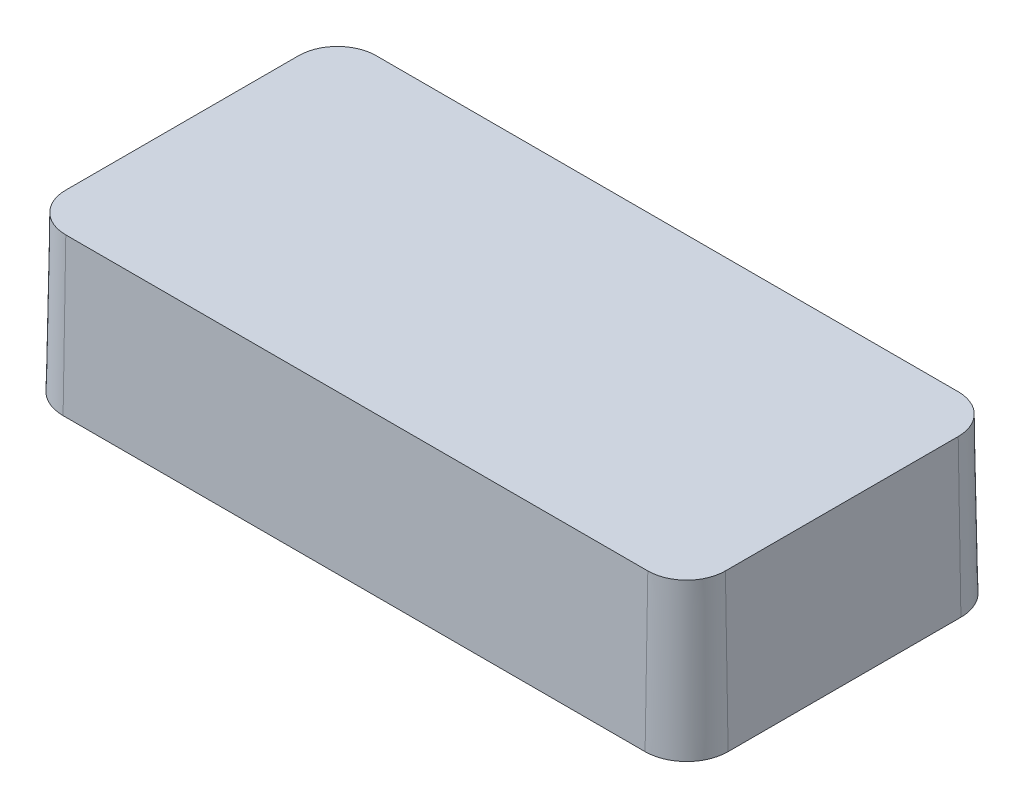
from build123d import *

# Parameters (mm, degrees)
BOSS_EXTRUDE1_DEPTH = 4
BOSS_EXTRUDE1_DRAFT = 1
SHELL1_T            = -0.5
SKETCH2_R           = 2
BOSS_EXTRUDE2_DEPTH = 5.5
BOSS_EXTRUDE2_TAPER = 1.5
CIRPATTERN1_COUNT   = 4


with BuildPart() as part:
    # Sketch1 → Boss-Extrude1 (with draft: the straight prism first)
    with BuildSketch(Plane(origin=(0, 0, 0), x_dir=(1, 0, 0), z_dir=(0, 1, 0))):
        with BuildLine():
            Line((-7.5, -4), (7.5, -4))
            ThreePointArc((7.5, -4), (8.207106781, -3.707106781), (8.5, -3))
            Line((8.5, -3), (8.5, 3))
            ThreePointArc((8.5, 3), (8.207106781, 3.707106781), (7.5, 4))
            Line((7.5, 4), (-7.5, 4))
            ThreePointArc((-7.5, 4), (-8.207106781, 3.707106781), (-8.5, 3))
            Line((-8.5, 3), (-8.5, -3))
            ThreePointArc((-8.5, -3), (-8.207106781, -3.707106781), (-7.5, -4))
        make_face()
    extrude(amount=-BOSS_EXTRUDE1_DEPTH)
    # Boss-Extrude1: the draft: its side faces are tilted about the plane it starts from
    boss_extrude1_sides = [part.faces().sort_by_distance(p)[0] for p in [
        (0, -2, 4),
        (8.207106781, -2, 3.707106781),
        (8.5, -2, 0),
        (8.207106781, -2, -3.707106781),
        (0, -2, -4),
        (-8.207106781, -2, -3.707106781),
        (-8.5, -2, 0),
        (-8.207106781, -2, 3.707106781),
    ]]
    draft(boss_extrude1_sides, Plane(origin=(0, 0, 0), x_dir=(1, 0, 0), z_dir=(0, 1, 0)), BOSS_EXTRUDE1_DRAFT)

    # Shell1
    shell1_openings = [part.faces().sort_by_distance(p)[0] for p in [
        (0, -4, 0),
    ]]
    offset(amount=SHELL1_T, openings=shell1_openings, kind=Kind.INTERSECTION)

    # Sketch2 → Boss-Extrude2 (add)
    with BuildSketch(Plane.XZ.offset(0.5)):
        Circle(SKETCH2_R)
    extrude(amount=BOSS_EXTRUDE2_DEPTH, taper=BOSS_EXTRUDE2_TAPER)

    # Rib1: read off the stored shape, not the designer's step
    # Rib1: loft between two sections, ruled curve by curve
    rib1_from = [
        Edge.make_line((1.982021306, -0.5, 0.267565961), (3, -0.5, 0.25)),
        Edge.make_line((1.982021306, -0.5, -0.267565961), (3, -0.5, -0.25)),
        Edge.make_line((3, -0.5, -0.25), (3, -0.5, 0.25)),
        Edge.make_line((1.982021306, -0.5, -0.267565961), (1.982021306, -0.5, 0.267565961)),
    ]
    rib1_to = [
        Edge.make_line((1.877496814, -4.5, 0.25884785), (2.390245469, -4.5, 0.25)),
        Edge.make_line((1.877496814, -4.5, -0.25884785), (2.390245469, -4.5, -0.25)),
        Edge.make_line((2.390245469, -4.5, -0.25), (2.390245469, -4.5, 0.25)),
        Edge.make_line((1.877496814, -4.5, -0.25884785), (1.877496814, -4.5, 0.25884785)),
    ]
    rib1 = Solid(Shell([*[Face.make_surface_from_curves(rib1_from[k], rib1_to[k]) for k in range(4)], Face(Wire(rib1_from)), Face(Wire(rib1_to))]))
    add(rib1)

    # CirPattern1: Rib1 ×4 about axis
    cirpattern1_axis = Axis((0, 0, 0), (0, 1, 0))
    for i in range(1, CIRPATTERN1_COUNT):
        add(rib1.rotate(cirpattern1_axis, i * 360 / CIRPATTERN1_COUNT))


solid = part.part
